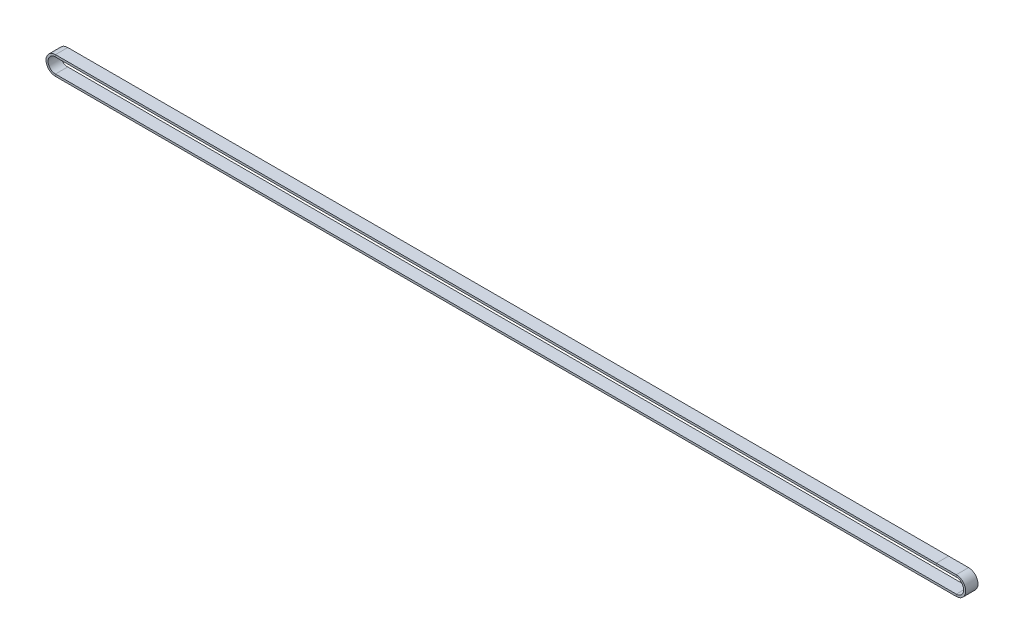
from build123d import *

# Parameters (mm, degrees)
SKETCH3_W = 9
SKETCH3_H = 1.5


with BuildPart() as part:
    # Sweep1: sweep along a path in Sketch2
    with BuildLine(Plane.XY) as sweep1_path:
        Line((-1.4, -6.9), (-660.332653819, -6.9))
        ThreePointArc((-660.332653819, -6.9), (-667.232653819, 0), (-660.332653819, 6.9))
        Line((-660.332653819, 6.9), (-1.4, 6.9))
        ThreePointArc((-1.4, 6.9), (5.5, 0), (-1.4, -6.9))
    # Sketch3 → Sweep1 (sweep)
    with BuildSketch(Plane(origin=(-16, 0, 0), x_dir=(0, 0, -1), z_dir=(1, 0, 0))):
        with Locations((-4.5, 6.15)):
            Rectangle(SKETCH3_W, SKETCH3_H)
    sweep(path=sweep1_path.line)


solid = part.part
